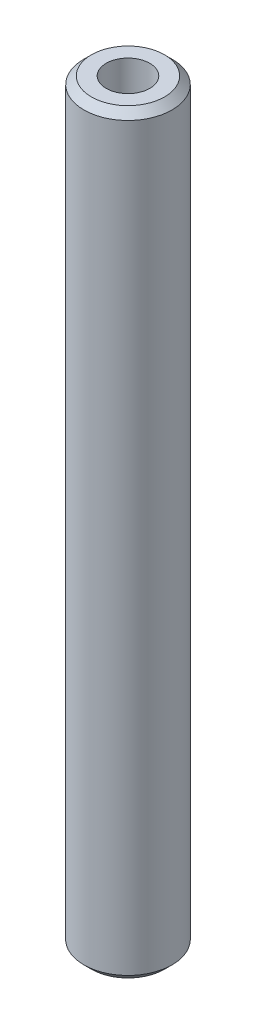
from build123d import *

# Parameters (mm, degrees)
SKETCH1_R           = 35
BOSS_EXTRUDE1_DEPTH = 600
SKETCH2_R           = 17.309276005
CUT_EXTRUDE1_DEPTH  = 603.038204768
CHAMFER1_SIZE       = 5.973542832


with BuildPart() as part:
    # Sketch1 → Boss-Extrude1 (new body)
    with BuildSketch(Plane(origin=(0, 0, 0), x_dir=(1, 0, 0), z_dir=(0, 1, 0))):
        Circle(SKETCH1_R)
    extrude(amount=BOSS_EXTRUDE1_DEPTH)

    # Sketch2 → Cut-Extrude1 (cut, through all)
    with BuildSketch(Plane(origin=(0, 0, 0), x_dir=(1, 0, 0), z_dir=(0, 1, 0))):
        Circle(SKETCH2_R)
    extrude(amount=CUT_EXTRUDE1_DEPTH, mode=Mode.SUBTRACT)

    # Chamfer1
    chamfer1_edges = [part.edges().sort_by_distance(p)[0] for p in [
        (-35, 600, 0),
        (-35, 0, 0),
    ]]
    chamfer(chamfer1_edges, length=CHAMFER1_SIZE)


solid = part.part
